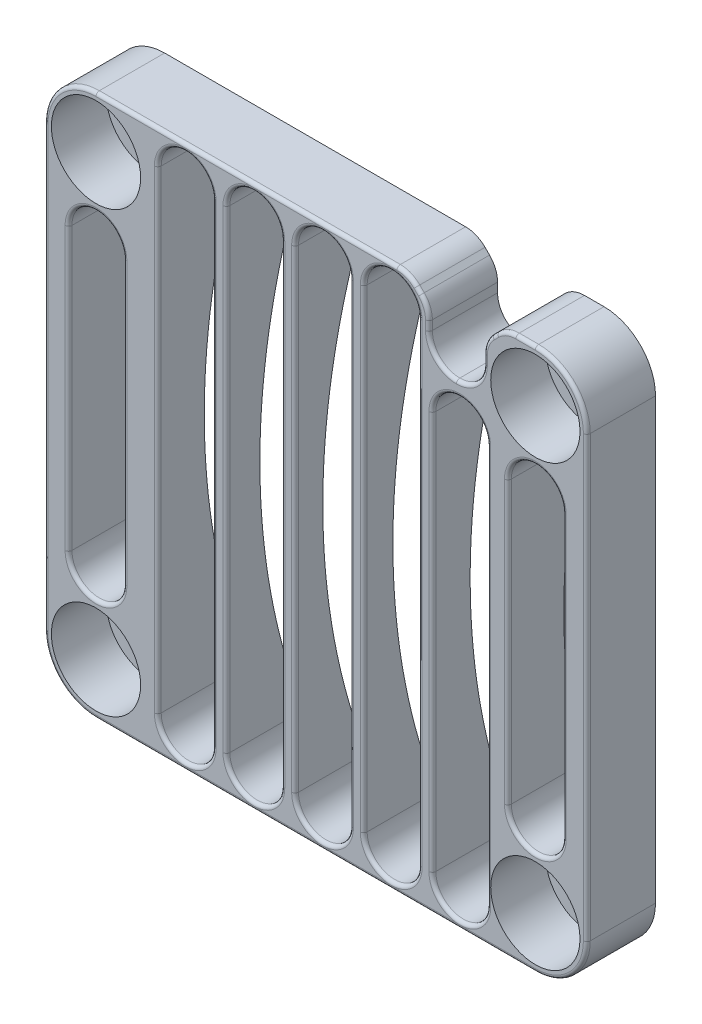
from build123d import *

# Parameters (mm, degrees)
BOSS_EXTRUDE1_DEPTH     = 5
CUT_EXTRUDE1_DEPTH      = 29.374724668
CUT_EXTRUDE1_DEPTH_BACK = 29.374724668
SKETCH2_R               = 1.75
SKETCH3_R               = 3.25
CUT_EXTRUDE2_DEPTH      = 4
MIRROR2_COPY_1_SKETCH_R = 3.25
MIRROR2_COPY_1_DEPTH    = 4
CUT_EXTRUDE3_DEPTH      = 29.374724668
CUT_EXTRUDE4_DEPTH      = 29.374724668
LPATTERN1_COUNT         = 5
LPATTERN1_PITCH         = 5
CUT_EXTRUDE5_DEPTH      = 29.374724668
CUT_EXTRUDE5_DEPTH_BACK = 29.374724668
FILLET5_R               = 2
CUT_EXTRUDE6_DEPTH      = 29.374724668
CUT_EXTRUDE6_DEPTH_BACK = 29.374724668
FILLET3_R               = 0.25
FILLET2_R               = 0.25


with BuildPart() as part:
    # Sketch1 → Boss-Extrude1 (new body)
    with BuildSketch(Plane.XY):
        with BuildLine():
            Line((19.75, 16), (19.75, -16))
            ThreePointArc((19.75, -16), (18.651650429, -18.651650429), (16, -19.75))
            Line((16, -19.75), (-16, -19.75))
            ThreePointArc((-16, -19.75), (-18.651650429, -18.651650429), (-19.75, -16))
            Line((-19.75, -16), (-19.75, 16))
            ThreePointArc((-19.75, 16), (-18.651650429, 18.651650429), (-16, 19.75))
            Line((-16, 19.75), (16, 19.75))
            ThreePointArc((16, 19.75), (18.651650429, 18.651650429), (19.75, 16))
        make_face()
    extrude(amount=BOSS_EXTRUDE1_DEPTH)

    # Sketch2 → Cut-Extrude1 (cut, two sides: drawn at the far end of the back side and taken through both)
    with BuildSketch(Plane(origin=(0, 0, 0), x_dir=(-1, 0, 0), z_dir=(0, 0, -1)).offset(-CUT_EXTRUDE1_DEPTH_BACK)):
        with Locations((-16, 16)):
            Circle(SKETCH2_R)
        with Locations((16, 16)):
            Circle(SKETCH2_R)
        with Locations((16, -16)):
            Circle(SKETCH2_R)
        with Locations((-16, -16)):
            Circle(SKETCH2_R)
    extrude(amount=CUT_EXTRUDE1_DEPTH + CUT_EXTRUDE1_DEPTH_BACK, mode=Mode.SUBTRACT)

    # Sketch3 → Cut-Extrude2 (cut)
    with BuildSketch(Plane.XY.offset(5)):
        with Locations((-16, 16)):
            Circle(SKETCH3_R)
    cut_extrude2 = extrude(amount=-CUT_EXTRUDE2_DEPTH, mode=Mode.SUBTRACT)

    # Mirror1: Cut-Extrude2 across plane
    add(cut_extrude2.mirror(Plane(origin=(0, 0, 0), x_dir=(0, 0, 1), z_dir=(1, 0, 0))), mode=Mode.SUBTRACT)

    # Mirror2: Cut-Extrude2 across plane
    add(cut_extrude2.mirror(Plane.ZX), mode=Mode.SUBTRACT)

    # Mirror2 copy 1 sketch → Mirror2 copy 1 (cut)
    with BuildSketch(Plane(origin=(0, 0, 5), x_dir=(-1, 0, 0), z_dir=(0, 0, 1))):
        with Locations((-16, 16)):
            Circle(MIRROR2_COPY_1_SKETCH_R)
    extrude(amount=-MIRROR2_COPY_1_DEPTH, mode=Mode.SUBTRACT)

    # Sketch4 → Cut-Extrude3 (cut, symmetric)
    with BuildSketch(Plane.XY.offset(5)):
        with BuildLine():
            Line((-14, 10.25), (-14, -10.25))
            ThreePointArc((-14, -10.25), (-16, -12.25), (-18, -10.25))
            Line((-18, -10.25), (-18, 10.25))
            ThreePointArc((-18, 10.25), (-16, 12.25), (-14, 10.25))
        make_face()
    cut_extrude3 = extrude(amount=CUT_EXTRUDE3_DEPTH, both=True, mode=Mode.SUBTRACT)

    # Mirror3: Cut-Extrude3 across plane
    add(cut_extrude3.mirror(Plane(origin=(0, 0, 0), x_dir=(0, 0, 1), z_dir=(1, 0, 0))), mode=Mode.SUBTRACT)

    # Sketch5 → Cut-Extrude4 (cut, symmetric)
    with BuildSketch(Plane.XY.offset(5)):
        with BuildLine():
            Line((-7.5, 17.25), (-7.5, -17.25))
            ThreePointArc((-7.5, -17.25), (-9.5, -19.25), (-11.5, -17.25))
            Line((-11.5, -17.25), (-11.5, 17.25))
            ThreePointArc((-11.5, 17.25), (-9.5, 19.25), (-7.5, 17.25))
        make_face()
    cut_extrude4 = extrude(amount=CUT_EXTRUDE4_DEPTH, both=True, mode=Mode.SUBTRACT)

    # LPattern1: Cut-Extrude4 ×5, 1 skipped
    with Locations(*[(i * LPATTERN1_PITCH, 0, 0) for i in range(1, LPATTERN1_COUNT) if i not in (4,)]):
        add(cut_extrude4, mode=Mode.SUBTRACT)

    # Sketch9 → Cut-Extrude5 (cut, two sides: drawn at the far end of the back side and taken through both)
    with BuildSketch(Plane.XY.offset(5).offset(-CUT_EXTRUDE5_DEPTH_BACK)):
        Polygon((12.25, 19.75), (8.25, 19.75), (6.75, 19.75), (8.25, 18.25), (8.25, 14.75), (12.25, 14.75), (12.25, 18.25), (13.75, 19.75), align=None)
    extrude(amount=CUT_EXTRUDE5_DEPTH + CUT_EXTRUDE5_DEPTH_BACK, mode=Mode.SUBTRACT)

    # Fillet5
    fillet5_edges = [part.edges().sort_by_distance(p)[0] for p in [
        (13.75, 19.75, 2.5),
        (12.25, 18.25, 2.5),
        (6.75, 19.75, 2.5),
        (8.25, 18.25, 2.5),
        (8.25, 14.75, 2.5),
        (12.25, 14.75, 2.5),
    ]]
    fillet(fillet5_edges, radius=FILLET5_R - 0.0001)  # a hair under: the kernel refuses the full size

    # Sketch10 → Cut-Extrude6 (cut, two sides: drawn at the far end of the back side and taken through both)
    with BuildSketch(Plane.XY.offset(5).offset(-CUT_EXTRUDE6_DEPTH_BACK)):
        with BuildLine():
            Line((12.5, 11.765686517), (12.5, -17.25))
            ThreePointArc((12.5, -17.25), (10.5, -19.25), (8.5, -17.25))
            Line((8.5, -17.25), (8.5, 11.765686517))
            ThreePointArc((8.5, 11.765686517), (10.5, 13.765686517), (12.5, 11.765686517))
        make_face()
    extrude(amount=CUT_EXTRUDE6_DEPTH + CUT_EXTRUDE6_DEPTH_BACK, mode=Mode.SUBTRACT)

    # Sketch6 → Cut-Revolve1 (revolve, cut)
    with BuildSketch(Plane(origin=(0, 0, 0), x_dir=(1, 0, 0), z_dir=(0, 1, 0))):
        with BuildLine():
            Line((0, 0), (0, -3))
            ThreePointArc((0, -3), (8.508268038, -2.244079877), (16.75, 0))
            Line((16.75, 0), (0, 0))
        make_face()
    revolve(axis=Axis((0, 0, -0.25), (0, 0, 1)), mode=Mode.SUBTRACT)

    # Fillet3
    fillet3_edges = [part.edges().sort_by_distance(p)[0] for p in [
        (-9.5, 19.25, 5),
        (-11.5, 0, 5),
        (-9.5, -19.25, 5),
        (-7.5, 0, 5),
        (-4.5, 19.25, 5),
        (-6.5, 0, 5),
        (-4.5, -19.25, 5),
        (-2.5, 0, 5),
        (0.5, 19.25, 5),
        (2.5, 0, 5),
        (0.5, -19.25, 5),
        (-1.5, 0, 5),
        (5.5, 19.25, 5),
        (7.5, 0, 5),
        (5.5, -19.25, 5),
        (3.5, 0, 5),
        (10.5, 13.765686517, 5),
        (8.5, -2.742156742, 5),
        (10.5, -19.25, 5),
        (12.5, -2.742156742, 5),
        (-16, 12.25, 5),
        (-18, 0, 5),
        (-16, -12.25, 5),
        (-14, 0, 5),
        (16, 12.25, 5),
        (18, 0, 5),
        (16, -12.25, 5),
        (14, 0, 5),
    ]]
    fillet(fillet3_edges, radius=FILLET3_R - 0.0001)  # a hair under: the kernel refuses the full size

    # Fillet2
    fillet2_edges = [part.edges().sort_by_distance(p)[0] for p in [
        (-18.651650429, 18.651650429, 5),
        (-19.75, 0, 5),
        (8.25, 17.085757148, 5),
        (12.25, 17.085757148, 5),
        (13, 19, 5),
        (7.5, 19, 5),
        (-5.039192852, 19.75, 5),
        (8.097766677, 18.186942893, 5),
        (6.686942893, 19.597766677, 5),
        (12.402233323, 18.186942893, 5),
        (13.813057107, 19.597766677, 5),
        (-18.651650429, -18.651650429, 5),
        (8.835757148, 15.335757148, 5),
        (11.664242852, 15.335757148, 5),
        (0, -19.75, 5),
        (18.651650429, -18.651650429, 5),
        (19.75, 0, 5),
        (18.651650429, 18.651650429, 5),
        (15.289192852, 19.75, 5),
    ]]
    fillet(fillet2_edges, radius=FILLET2_R)


solid = part.part
